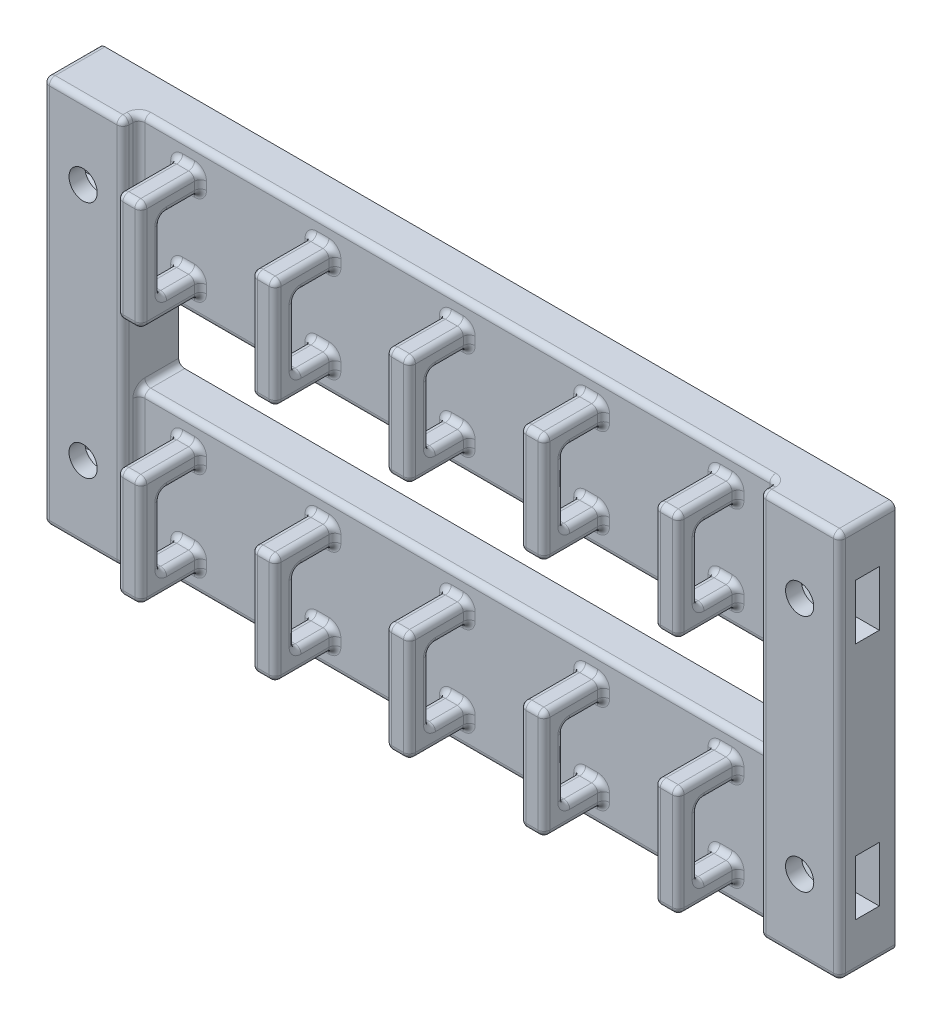
from build123d import *

# Parameters (mm, degrees)
SKETCH2_W              = 101.6
SKETCH2_H              = 19.05
BOSS_EXTRUDE1_DEPTH    = 5.08
BOSS_EXTRUDE3_DEPTH    = 1.524
FILLET2_R              = 0.762
LPATTERN2_COUNT        = 5
LPATTERN2_PITCH        = 17.145
FILLET2_OF_LPATTERN2_R = 0.762
SKETCH8_W              = 10.16
SKETCH8_H              = 19.05
BOSS_EXTRUDE4_DEPTH    = 2.032
M3_CLEARANCE_HOLE1_D   = 3.6
CUT_EXTRUDE1_DEPTH     = 3.048
LPATTERN3_COUNT        = 2
LPATTERN3_PITCH        = 30.48
SKETCH9_W              = 10.16
SKETCH9_H              = 11.43
BOSS_EXTRUDE5_DEPTH    = 7.112
FILLET3_R              = 0.762


with BuildPart() as part:
    # Sketch2 → Boss-Extrude1 (new body)
    with BuildSketch(Plane.XY):
        with Locations((50.8, 9.525)):
            Rectangle(SKETCH2_W, SKETCH2_H)
    extrude(amount=BOSS_EXTRUDE1_DEPTH)

    # Sketch6 → Boss-Extrude3 (add, symmetric)
    with BuildSketch(Plane.ZY.offset(-16.51)):
        Polygon((5.08, 16.51), (12.7, 16.51), (12.7, 2.54), (5.08, 2.54), (5.08, 5.08), (10.16, 5.08), (10.16, 13.97), (5.08, 13.97), align=None)
    boss_extrude3 = extrude(amount=BOSS_EXTRUDE3_DEPTH, both=True)

    # Fillet2
    fillet2_edges = [part.edges().sort_by_distance(p)[0] for p in [
        (16.51, 16.51, 5.08),
        (16.51, 2.54, 5.08),
        (16.51, 5.08, 5.08),
        (16.51, 13.97, 5.08),
        (16.51, 13.97, 10.16),
        (16.51, 5.08, 10.16),
        (18.034, 13.97, 7.62),
        (18.034, 9.525, 10.16),
        (18.034, 5.08, 7.62),
        (18.034, 3.81, 5.08),
        (18.034, 2.54, 8.89),
        (18.034, 9.525, 12.7),
        (18.034, 16.51, 8.89),
        (18.034, 15.24, 5.08),
        (14.986, 16.51, 8.89),
        (14.986, 9.525, 12.7),
        (14.986, 2.54, 8.89),
        (14.986, 3.81, 5.08),
        (14.986, 5.08, 7.62),
        (14.986, 9.525, 10.16),
        (14.986, 13.97, 7.62),
        (14.986, 15.24, 5.08),
        (16.51, 2.54, 12.7),
        (16.51, 16.51, 12.7),
    ]]
    fillet(fillet2_edges, radius=FILLET2_R)

    # LPattern2: Boss-Extrude3 ×5
    with Locations(*[(i * LPATTERN2_PITCH, 0, 0) for i in range(1, LPATTERN2_COUNT)]):
        add(boss_extrude3)

    # Fillet2 of LPattern2
    fillet2_of_lpattern2_edges = [part.edges().sort_by_distance(p)[0] for p in [
        (33.655, 16.51, 5.08),
        (33.655, 2.54, 5.08),
        (33.655, 5.08, 5.08),
        (33.655, 13.97, 5.08),
        (33.655, 13.97, 10.16),
        (33.655, 5.08, 10.16),
        (35.179, 13.97, 7.62),
        (35.179, 9.525, 10.16),
        (35.179, 5.08, 7.62),
        (35.179, 3.81, 5.08),
        (35.179, 2.54, 8.89),
        (35.179, 9.525, 12.7),
        (35.179, 16.51, 8.89),
        (35.179, 15.24, 5.08),
        (32.131, 16.51, 8.89),
        (32.131, 9.525, 12.7),
        (32.131, 2.54, 8.89),
        (32.131, 3.81, 5.08),
        (32.131, 5.08, 7.62),
        (32.131, 9.525, 10.16),
        (32.131, 13.97, 7.62),
        (32.131, 15.24, 5.08),
        (33.655, 2.54, 12.7),
        (33.655, 16.51, 12.7),
        (50.8, 16.51, 5.08),
        (50.8, 2.54, 5.08),
        (50.8, 5.08, 5.08),
        (50.8, 13.97, 5.08),
        (50.8, 13.97, 10.16),
        (50.8, 5.08, 10.16),
        (52.324, 13.97, 7.62),
        (52.324, 9.525, 10.16),
        (52.324, 5.08, 7.62),
        (52.324, 3.81, 5.08),
        (52.324, 2.54, 8.89),
        (52.324, 9.525, 12.7),
        (52.324, 16.51, 8.89),
        (52.324, 15.24, 5.08),
        (49.276, 16.51, 8.89),
        (49.276, 9.525, 12.7),
        (49.276, 2.54, 8.89),
        (49.276, 3.81, 5.08),
        (49.276, 5.08, 7.62),
        (49.276, 9.525, 10.16),
        (49.276, 13.97, 7.62),
        (49.276, 15.24, 5.08),
        (50.8, 2.54, 12.7),
        (50.8, 16.51, 12.7),
        (67.945, 16.51, 5.08),
        (67.945, 2.54, 5.08),
        (67.945, 5.08, 5.08),
        (67.945, 13.97, 5.08),
        (67.945, 13.97, 10.16),
        (67.945, 5.08, 10.16),
        (69.469, 13.97, 7.62),
        (69.469, 9.525, 10.16),
        (69.469, 5.08, 7.62),
        (69.469, 3.81, 5.08),
        (69.469, 2.54, 8.89),
        (69.469, 9.525, 12.7),
        (69.469, 16.51, 8.89),
        (69.469, 15.24, 5.08),
        (66.421, 16.51, 8.89),
        (66.421, 9.525, 12.7),
        (66.421, 2.54, 8.89),
        (66.421, 3.81, 5.08),
        (66.421, 5.08, 7.62),
        (66.421, 9.525, 10.16),
        (66.421, 13.97, 7.62),
        (66.421, 15.24, 5.08),
        (67.945, 2.54, 12.7),
        (67.945, 16.51, 12.7),
        (85.09, 16.51, 5.08),
        (85.09, 2.54, 5.08),
        (85.09, 5.08, 5.08),
        (85.09, 13.97, 5.08),
        (85.09, 13.97, 10.16),
        (85.09, 5.08, 10.16),
        (86.614, 13.97, 7.62),
        (86.614, 9.525, 10.16),
        (86.614, 5.08, 7.62),
        (86.614, 3.81, 5.08),
        (86.614, 2.54, 8.89),
        (86.614, 9.525, 12.7),
        (86.614, 16.51, 8.89),
        (86.614, 15.24, 5.08),
        (83.566, 16.51, 8.89),
        (83.566, 9.525, 12.7),
        (83.566, 2.54, 8.89),
        (83.566, 3.81, 5.08),
        (83.566, 5.08, 7.62),
        (83.566, 9.525, 10.16),
        (83.566, 13.97, 7.62),
        (83.566, 15.24, 5.08),
        (85.09, 2.54, 12.7),
        (85.09, 16.51, 12.7),
    ]]
    fillet(fillet2_of_lpattern2_edges, radius=FILLET2_OF_LPATTERN2_R)

    # Sketch8 → Boss-Extrude4 (add)
    with BuildSketch(Plane.XY.offset(5.08)):
        with Locations((5.08, 9.525)):
            Rectangle(SKETCH8_W, SKETCH8_H)
        with Locations((96.52, 9.525)):
            Rectangle(SKETCH8_W, SKETCH8_H)
    extrude(amount=BOSS_EXTRUDE4_DEPTH)

    # M3 Clearance Hole1 (through all)
    with Locations(Plane(origin=(0, 0, 0), x_dir=(1, 0, 0), z_dir=(0, 0, -1))):
        with Locations((5.08, -9.525), (96.52, -9.525)):
            Hole(M3_CLEARANCE_HOLE1_D / 2)

    # Sketch7 → Cut-Extrude1 (cut)
    with BuildSketch(Plane(origin=(0, 0, 5.08), x_dir=(-1, 0, 0), z_dir=(0, 0, -1))):
        Polygon((-96.52, 6.005472759), (-93.472, 7.76523638), (-93.472, 11.28476362), (-96.52, 13.044527241), (-101.6, 13.044527241), (-101.6, 6.005472759), align=None)
        Polygon((-8.128, 7.76523638), (-5.08, 6.005472759), (0, 6.005472759), (0, 13.044527241), (-5.08, 13.044527241), (-8.128, 11.28476362), align=None)
    extrude(amount=CUT_EXTRUDE1_DEPTH, mode=Mode.SUBTRACT)


with BuildPart() as lpattern3_1:
    # LPattern3: pattern copy
    add(part.part.moved(Location(Vector(0, 1, 0) * (1 * LPATTERN3_PITCH))))


with BuildPart() as part_1:
    add(part.part)

    add(lpattern3_1.part)  # Boss-Extrude5 merges LPattern3_1
    # Sketch9 → Boss-Extrude5 (add)
    with BuildSketch(Plane(origin=(0, 0, 0), x_dir=(-1, 0, 0), z_dir=(0, 0, -1))):
        with Locations((-96.52, 24.765)):
            Rectangle(SKETCH9_W, SKETCH9_H)
        with Locations((-5.08, 24.765)):
            Rectangle(SKETCH9_W, SKETCH9_H)
    extrude(amount=-BOSS_EXTRUDE5_DEPTH)

    # Fillet3
    fillet3_edges = [part_1.edges().sort_by_distance(p)[0] for p in [
        (50.8, 0, 5.08),
        (50.8, 19.05, 5.08),
        (10.16, 0, 6.096),
        (91.44, 0, 6.096),
        (10.16, 19.05, 2.54),
        (91.44, 19.05, 2.54),
        (10.16, 24.765, 7.112),
        (5.08, 0, 7.112),
        (0, 24.765, 7.112),
        (96.52, 0, 7.112),
        (91.44, 24.765, 7.112),
        (101.6, 24.765, 7.112),
        (10.16, 9.525, 5.08),
        (91.44, 9.525, 5.08),
        (0, 0, 3.556),
        (101.6, 0, 3.556),
        (5.08, 49.53, 7.112),
        (96.52, 49.53, 7.112),
        (10.16, 30.48, 2.54),
        (91.44, 30.48, 2.54),
        (10.16, 49.53, 6.096),
        (91.44, 49.53, 6.096),
        (50.8, 30.48, 5.08),
        (10.16, 40.005, 5.08),
        (50.8, 49.53, 5.08),
        (91.44, 40.005, 5.08),
        (101.6, 49.53, 3.556),
        (0, 49.53, 3.556),
    ]]
    fillet(fillet3_edges, radius=FILLET3_R)


solid = part_1.part
